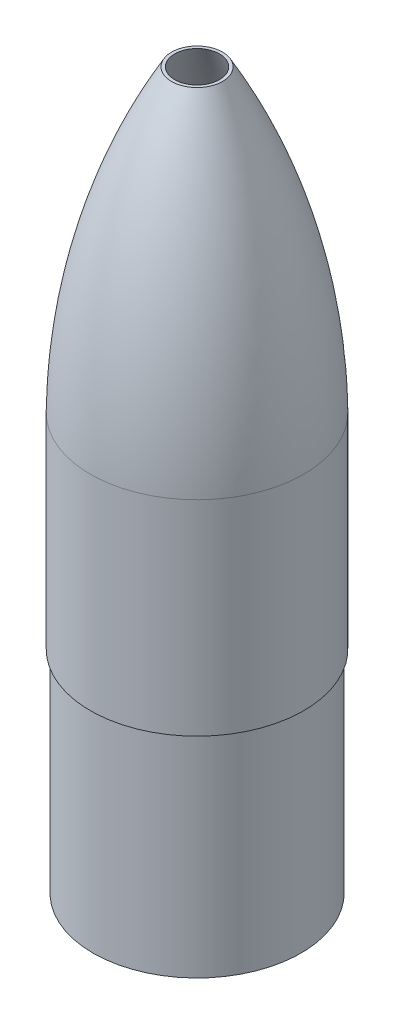
from build123d import *

# Parameters (mm, degrees)
BOSS_EXTRUDE1_START = -304.8
SKETCH2_R           = 76.2
SKETCH2_R_2         = 73.2
BOSS_EXTRUDE1_DEPTH = 304.8
SKETCH3_R           = 126.460441223
CUT_EXTRUDE1_DEPTH  = 30


with BuildPart() as part:
    # Sketch1 → Revolve3 (revolve)
    with BuildSketch(Plane.XY):
        with BuildLine():
            Line((78.16, 0.555796301), (78.16, 150.555796301))
            add(Edge.make_bspline(
                [(0, 400), (0.211335822, 399.688125951), (0.635814895, 399.059576984), (1.538100901, 397.718447682), (2.522216135, 396.240558988), (3.505644669, 394.750882712), (4.501021999, 393.230772914), (5.482794304, 391.717940875), (6.460002487, 390.1990457), (7.436503499, 388.667903295), (8.412102246, 387.124567018), (16.491350088, 374.228806244), (28.348045348, 353.344444451), (42.541088503, 323.752786496), (57.529234868, 282.998416237), (68.449765851, 242.872883661), (74.109605793, 210.076821303), (76.655852831, 184.808563), (77.518465345, 170.067485067), (77.680444963, 166.851372886), (77.80019329, 164.105278722), (77.872037245, 162.29067577), (77.936311693, 160.485721023), (77.993377873, 158.683168323), (78.043426294, 156.866740105), (78.085914262, 155.082628956), (78.121127528, 153.306463123), (78.145475643, 151.691137071), (78.155577952, 150.932503957), (78.16, 150.555796301)],
                knots=[0.082616428, 0.082616428, 0.082616428, 0.082616428, 0.082616428, 0.088299706, 0.093982984, 0.099666263, 0.105349541, 0.111032819, 0.116716097, 0.122399375, 0.128082653, 0.133891142, 0.139699631, 0.313954311, 0.430124092, 0.546293874, 0.685697612, 0.836718331, 0.848335309, 0.865760775, 0.871569264, 0.877252541, 0.882935819, 0.888619096, 0.894302373, 0.899985651, 0.905668928, 0.911352205, 0.917035483, 0.917035483, 0.917035483, 0.917035483, 0.917035483], degree=4))
            Line((0, 400), (0, 396.489212171))
            add(Edge.make_bspline(
                [(0, 396.489212171), (0.033950421, 396.438447854), (0.270297298, 396.084910627), (0.687269239, 395.458986868), (1.248256795, 394.612262217), (1.999478916, 393.472916562), (3.322990367, 391.451301251), (5.182734219, 388.567106013), (9.592096746, 381.590651127), (18.79448878, 366.267083026), (36.794305295, 332.203153979), (57.076508975, 280.924103704), (69.684732597, 227.240425292), (74.343019544, 188.995844434), (75.530951553, 171.160960641), (75.891349594, 162.915707977), (76.010098219, 159.486050775), (76.07694035, 157.070550778), (76.110246707, 155.706228582), (76.132780312, 154.690650434), (76.153251031, 153.650034533), (76.172421756, 152.520648044), (76.189027326, 151.409738144), (76.196427769, 150.847643517), (76.2, 150.54427492)],
                knots=[0.091851146, 0.091851146, 0.091851146, 0.091851146, 0.092394266, 0.095653545, 0.098912824, 0.102172103, 0.108690662, 0.121727778, 0.134764895, 0.186913362, 0.291210296, 0.499804164, 0.708398032, 0.812694966, 0.864843432, 0.877880549, 0.890917666, 0.897436224, 0.900695504, 0.903954783, 0.907214062, 0.910473341, 0.91373262, 0.916991899, 0.916991899, 0.916991899, 0.916991899], degree=3))
            Line((76.2, 150.54427492), (76.2, 0.555796301))
            Line((76.2, 0.555796301), (78.16, 0.555796301))
        make_face()
    revolve(axis=Axis((0, -198.817850362, 0), (0, -1, 0)))

    # Sketch2 → Boss-Extrude1 (add)
    with BuildSketch(Plane(origin=(0, 150.555796301, 0), x_dir=(1, 0, 0), z_dir=(0, 1, 0)).offset(BOSS_EXTRUDE1_START)):
        Circle(SKETCH2_R)
        Circle(SKETCH2_R_2, mode=Mode.SUBTRACT)
    extrude(amount=BOSS_EXTRUDE1_DEPTH)

    # Sketch3 → Cut-Extrude1 (cut)
    with BuildSketch(Plane(origin=(0, 400, 0), x_dir=(-1, 0, 0), z_dir=(0, -1, 0))):
        Circle(SKETCH3_R)
    extrude(amount=CUT_EXTRUDE1_DEPTH, mode=Mode.SUBTRACT)


solid = part.part
